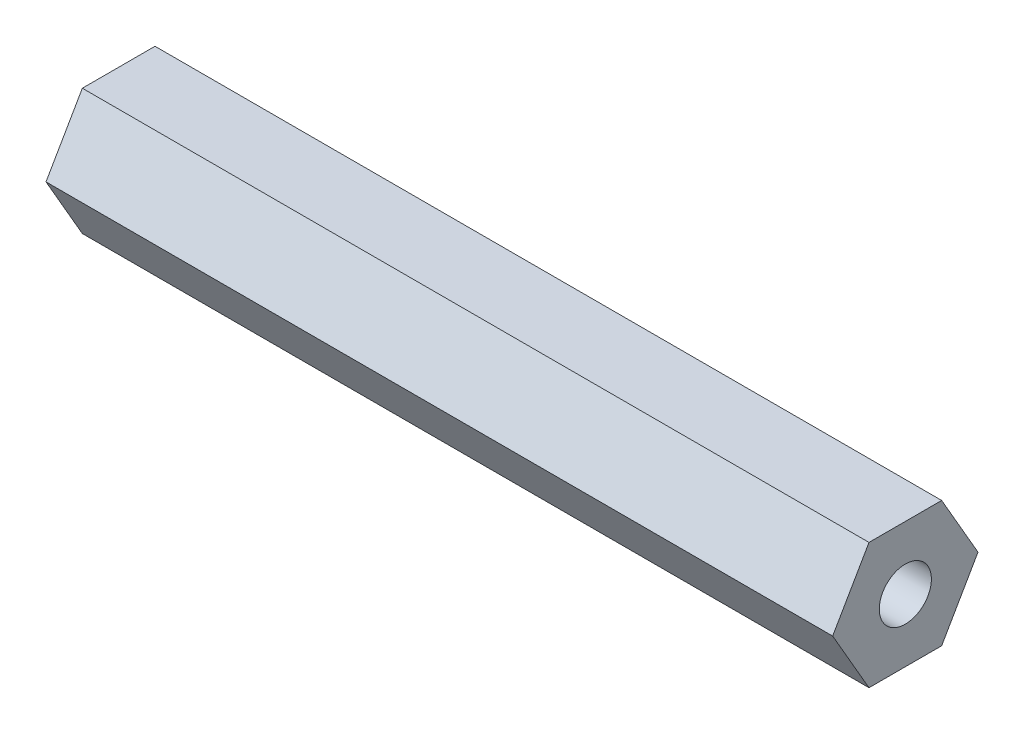
from build123d import *

# Parameters (mm, degrees)
SKETCH1_R           = 2.6289
BOSS_EXTRUDE1_DEPTH = 79.375


with BuildPart() as part:
    # Sketch1 → Boss-Extrude1 (new body)
    with BuildSketch(Plane(origin=(0, 0, 0), x_dir=(0, 0, -1), z_dir=(1, 0, 0))):
        Polygon((3.666174209, 6.35), (-3.666174209, 6.35), (-7.332348419, 0), (-3.666174209, -6.35), (3.666174209, -6.35), (7.332348419, 0), align=None)
        Circle(SKETCH1_R, mode=Mode.SUBTRACT)
    extrude(amount=BOSS_EXTRUDE1_DEPTH)


solid = part.part
